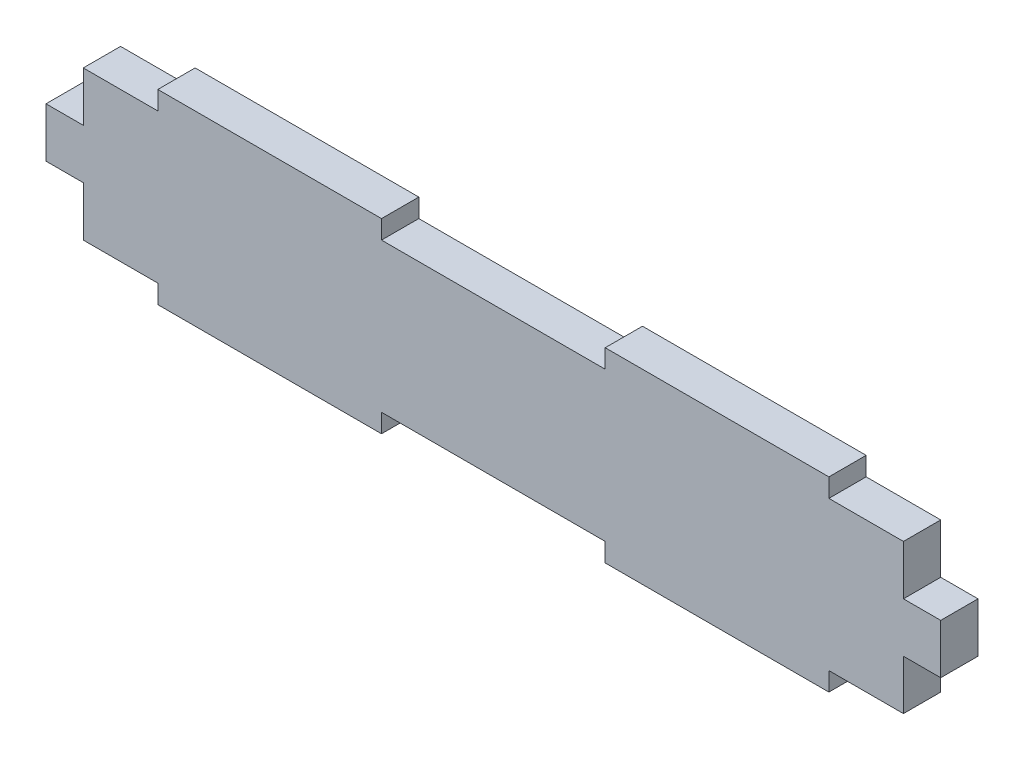
from build123d import *

# Parameters (mm, degrees)
SKETCH1_W           = 304.8
SKETCH1_H           = 50.8
BOSS_EXTRUDE1_DEPTH = 12.7
SKETCH2_W           = 76.2
SKETCH2_H           = 6.35
BOSS_EXTRUDE2_DEPTH = 12.7
SKETCH3_W           = 12.7
SKETCH3_H           = 16.933333333
CUT_EXTRUDE1_DEPTH  = 157.189348228


with BuildPart() as part:
    # Sketch1 → Boss-Extrude1 (new body)
    with BuildSketch(Plane.XY):
        Rectangle(SKETCH1_W, SKETCH1_H)
    extrude(amount=BOSS_EXTRUDE1_DEPTH)

    # Sketch2 → Boss-Extrude2 (add)
    with BuildSketch(Plane.XY.offset(12.7)):
        with Locations((-76.2, -28.575)):
            Rectangle(SKETCH2_W, SKETCH2_H)
        with Locations((76.2, -28.575)):
            Rectangle(SKETCH2_W, SKETCH2_H)
        with Locations((76.2, 28.575)):
            Rectangle(SKETCH2_W, SKETCH2_H)
        with Locations((-76.2, 28.575)):
            Rectangle(SKETCH2_W, SKETCH2_H)
    extrude(amount=-BOSS_EXTRUDE2_DEPTH)

    # Sketch3 → Cut-Extrude1 (cut, through all)
    with BuildSketch(Plane.XY.offset(12.7)):
        with Locations((-146.05, -16.933333334)):
            Rectangle(SKETCH3_W, SKETCH3_H)
        with Locations((-146.05, 16.933333334)):
            Rectangle(SKETCH3_W, SKETCH3_H)
        with Locations((146.05, 16.933333334)):
            Rectangle(SKETCH3_W, SKETCH3_H)
        with Locations((146.05, -16.933333334)):
            Rectangle(SKETCH3_W, SKETCH3_H)
    extrude(amount=-CUT_EXTRUDE1_DEPTH, mode=Mode.SUBTRACT)


solid = part.part
